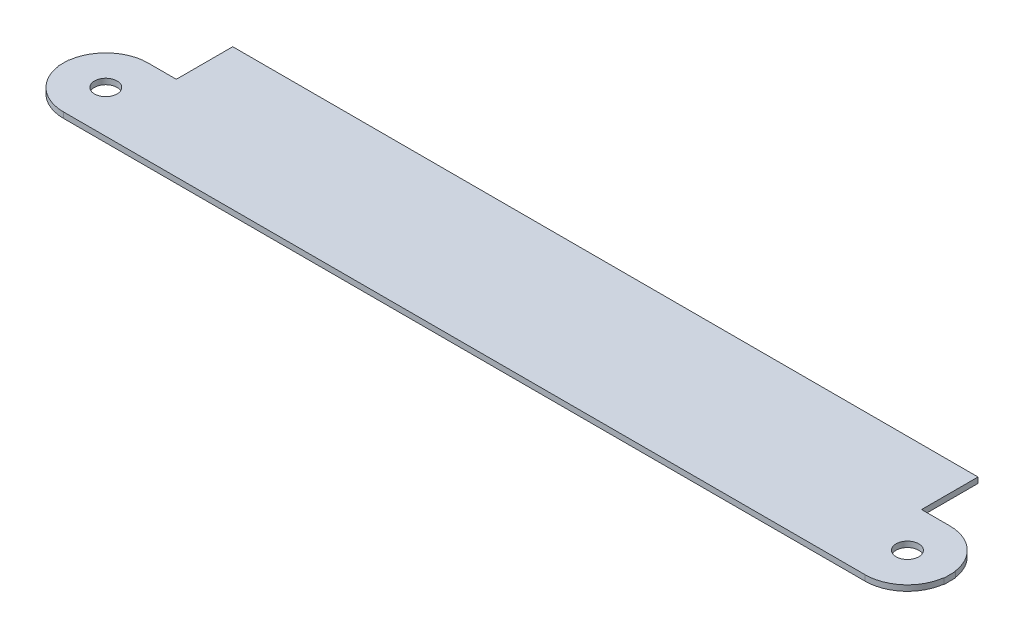
from build123d import *

# Parameters (mm, degrees)
SKETCH1_R           = 2
BOSS_EXTRUDE1_DEPTH = 1


with BuildPart() as part:
    # Sketch1 → Boss-Extrude1 (new body)
    with BuildSketch(Plane(origin=(0, 0, 0), x_dir=(1, 0, 0), z_dir=(0, 1, 0))):
        with BuildLine():
            Line((5, 7.5), (0, 7.5))
            ThreePointArc((0, 7.5), (-4.937104415, 5.645794895), (-7.433034374, 1))
            Line((-7.433034374, 1), (-7.5, 1))
            Line((-7.5, 1), (-7.5, -1))
            Line((-7.5, -1), (-7.433034374, -1))
            ThreePointArc((-7.433034374, -1), (-4.937104415, -5.645794895), (0, -7.5))
            Line((0, -7.5), (142.06, -7.5))
            ThreePointArc((142.06, -7.5), (146.997104415, -5.645794895), (149.493034374, -1))
            Line((149.493034374, -1), (149.56, -1))
            Line((149.56, -1), (149.56, 1))
            Line((149.56, 1), (149.493034374, 1))
            ThreePointArc((149.493034374, 1), (146.997104415, 5.645794895), (142.06, 7.5))
            Line((142.06, 7.5), (137.06, 7.5))
            Line((137.06, 7.5), (137.06, 17.5))
            Line((137.06, 17.5), (5, 17.5))
            Line((5, 17.5), (5, 7.5))
        make_face()
        Circle(SKETCH1_R, mode=Mode.SUBTRACT)
        with Locations((142.06, 0)):
            Circle(SKETCH1_R, mode=Mode.SUBTRACT)
    extrude(amount=BOSS_EXTRUDE1_DEPTH)


solid = part.part
